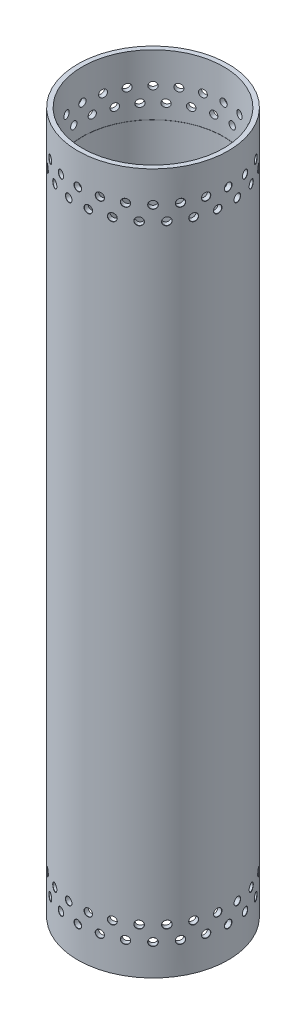
from build123d import *

# Parameters (mm, degrees)
SZKIC1_R                    = 90
SZKIC1_R_2                  = 81.5
DODANIE_WYCI_GNI_CIE1_DEPTH = 810
SZKIC2_R                    = 90
SZKIC2_R_2                  = 87
WYTNIJ_WYCI_GNI_CIE1_DEPTH  = 820.939022123
WYTNIJ_WYCI_GNI_CIE2_START  = -70
SZKIC3_R                    = 81.7
SZKIC3_R_2                  = 81.5
WYTNIJ_WYCI_GNI_CIE2_DEPTH  = 70
SZYK_KO_OWY1_COUNT          = 24


with BuildPart() as part:
    # Szkic1 → Dodanie-wyciągnięcie1 (new body)
    with BuildSketch(Plane(origin=(0, 0, 0), x_dir=(1, 0, 0), z_dir=(0, 1, 0))):
        with Locations(Location((0, 0, 0), (0, 0, 270))):
            Circle(SZKIC1_R)
        with Locations(Location((0, 0, 0), (0, 0, 270))):
            Circle(SZKIC1_R_2, mode=Mode.SUBTRACT)
    extrude(amount=DODANIE_WYCI_GNI_CIE1_DEPTH)

    # Szkic2 → Wytnij-wyciągnięcie1 (cut, through all)
    with BuildSketch(Plane(origin=(0, 810, 0), x_dir=(1, 0, 0), z_dir=(0, 1, 0))):
        Circle(SZKIC2_R)
        with Locations(Location((0, 0, 0), (0, 0, 270))):
            Circle(SZKIC2_R_2, mode=Mode.SUBTRACT)
    extrude(amount=-WYTNIJ_WYCI_GNI_CIE1_DEPTH, mode=Mode.SUBTRACT)

    # Szkic3 → Wytnij-wyciągnięcie2 (cut)
    with BuildSketch(Plane(origin=(0, 810, 0), x_dir=(1, 0, 0), z_dir=(0, 1, 0)).offset(WYTNIJ_WYCI_GNI_CIE2_START)):
        with Locations(Location((0, 0, 0), (0, 0, 270))):
            Circle(SZKIC3_R)
        with Locations(Location((0, 0, 0), (0, 0, 270))):
            Circle(SZKIC3_R_2, mode=Mode.SUBTRACT)
    wytnij_wyci_gni_cie2 = extrude(amount=WYTNIJ_WYCI_GNI_CIE2_DEPTH, mode=Mode.SUBTRACT)

    # Otwór Ø8.5 (8.5)1: read off the stored shape, not the designer's step
    # Otwór Ø8.5 (8.5)1 outline → Otwór Ø8.5 (8.5)1 (revolve, cut)
    with BuildSketch(Plane.XZ.offset(-774)):
        Polygon((0, 81.589336122), (4.25, 81.589336122), (4.25, 86.75), (4.500000084, 87.000000084), (0, 87.000000084), align=None)
    otw_r_8_5_8_5_1 = revolve(axis=Axis((0, 774, 0), (0, 0, 1)), mode=Mode.SUBTRACT)

    # Otwór Ø8.5 (8.5)2: read off the stored shape, not the designer's step
    # Otwór Ø8.5 (8.5)2 outline → Otwór Ø8.5 (8.5)2 (revolve, cut)
    with BuildSketch(Plane(origin=(0, 757, 0), x_dir=(0.9914448613738103, 0, -0.13052619222005205), z_dir=(0, -1, 0))):
        Polygon((0, 81.589323977), (4.25, 81.589323977), (4.25, 86.75), (4.500063259, 87.000063259), (0, 87.000063259), align=None)
    otw_r_8_5_8_5_2 = revolve(axis=Axis((0, 757, 0), (0.13052619222005205, 0, 0.9914448613738103)), mode=Mode.SUBTRACT)

    # Szyk kołowy1: Otwór Ø8.5 (8.5)1, Otwór Ø8.5 (8.5)2 ×24 about axis
    szyk_ko_owy1_axis = Axis((0, 0, 0), (0, 1, 0))
    add([otw_r_8_5_8_5_1.rotate(szyk_ko_owy1_axis, i * 360 / SZYK_KO_OWY1_COUNT) for i in range(1, SZYK_KO_OWY1_COUNT)], mode=Mode.SUBTRACT)
    add([otw_r_8_5_8_5_2.rotate(szyk_ko_owy1_axis, i * 360 / SZYK_KO_OWY1_COUNT) for i in range(1, SZYK_KO_OWY1_COUNT)], mode=Mode.SUBTRACT)

    # Lustro1: Wytnij-wyciągnięcie2, Otwór Ø8.5 (8.5)1, Otwór Ø8.5 (8.5)2 across plane
    add(wytnij_wyci_gni_cie2.mirror(Plane.ZX.offset(405)), mode=Mode.SUBTRACT)
    add(otw_r_8_5_8_5_1.mirror(Plane.ZX.offset(405)), mode=Mode.SUBTRACT)
    add(otw_r_8_5_8_5_2.mirror(Plane.ZX.offset(405)), mode=Mode.SUBTRACT)

    # Lustro1 copy 1 sketch → Lustro1 copy 1 (revolve, cut)
    with BuildSketch(Plane(origin=(0, 36, 0), x_dir=(0.9659258262890683, 0, -0.25881904510252074), z_dir=(0, 1, 0))):
        Polygon((0, -81.589336122), (4.25, -81.589336122), (4.25, -86.75), (4.500000084, -87.000000084), (0, -87.000000084), align=None)
    revolve(axis=Axis((0, 36, 0), (-0.25881904510252074, 0, -0.9659258262890683)), mode=Mode.SUBTRACT)

    # Lustro1 copy 2 sketch → Lustro1 copy 2 (revolve, cut)
    with BuildSketch(Plane(origin=(0, 36, 0), x_dir=(0.8660254037844387, 0, -0.49999999999999994), z_dir=(0, 1, 0))):
        Polygon((0, -81.589336122), (4.25, -81.589336122), (4.25, -86.75), (4.500000084, -87.000000084), (0, -87.000000084), align=None)
    revolve(axis=Axis((0, 36, 0), (-0.49999999999999994, 0, -0.8660254037844387)), mode=Mode.SUBTRACT)

    # Lustro1 copy 3 sketch → Lustro1 copy 3 (revolve, cut)
    with BuildSketch(Plane(origin=(0, 36, 0), x_dir=(0.7071067811865476, 0, -0.7071067811865475), z_dir=(0, 1, 0))):
        Polygon((0, -81.589336122), (4.25, -81.589336122), (4.25, -86.75), (4.500000084, -87.000000084), (0, -87.000000084), align=None)
    revolve(axis=Axis((0, 36, 0), (-0.7071067811865475, 0, -0.7071067811865476)), mode=Mode.SUBTRACT)

    # Lustro1 copy 4 sketch → Lustro1 copy 4 (revolve, cut)
    with BuildSketch(Plane(origin=(0, 36, 0), x_dir=(0.5000000000000001, 0, -0.8660254037844386), z_dir=(0, 1, 0))):
        Polygon((0, -81.589336122), (4.25, -81.589336122), (4.25, -86.75), (4.500000084, -87.000000084), (0, -87.000000084), align=None)
    revolve(axis=Axis((0, 36, 0), (-0.8660254037844386, 0, -0.5000000000000001)), mode=Mode.SUBTRACT)

    # Lustro1 copy 5 sketch → Lustro1 copy 5 (revolve, cut)
    with BuildSketch(Plane(origin=(0, 36, 0), x_dir=(0.25881904510252074, 0, -0.9659258262890683), z_dir=(0, 1, 0))):
        Polygon((0, -81.589336122), (4.25, -81.589336122), (4.25, -86.75), (4.500000084, -87.000000084), (0, -87.000000084), align=None)
    revolve(axis=Axis((0, 36, 0), (-0.9659258262890683, 0, -0.25881904510252074)), mode=Mode.SUBTRACT)

    # Lustro1 copy 6 sketch → Lustro1 copy 6 (revolve, cut)
    with BuildSketch(Plane(origin=(0, 36, 0), x_dir=(0, 0, -1), z_dir=(0, 1, 0))):
        Polygon((0, -81.589336122), (4.25, -81.589336122), (4.25, -86.75), (4.500000084, -87.000000084), (0, -87.000000084), align=None)
    revolve(axis=Axis((0, 36, 0), (-1, 0, 0)), mode=Mode.SUBTRACT)

    # Lustro1 copy 7 sketch → Lustro1 copy 7 (revolve, cut)
    with BuildSketch(Plane(origin=(0, 36, 0), x_dir=(-0.25881904510252085, 0, -0.9659258262890683), z_dir=(0, 1, 0))):
        Polygon((0, -81.589336122), (4.25, -81.589336122), (4.25, -86.75), (4.500000084, -87.000000084), (0, -87.000000084), align=None)
    revolve(axis=Axis((0, 36, 0), (-0.9659258262890683, 0, 0.25881904510252085)), mode=Mode.SUBTRACT)

    # Lustro1 copy 8 sketch → Lustro1 copy 8 (revolve, cut)
    with BuildSketch(Plane(origin=(0, 36, 0), x_dir=(-0.4999999999999998, 0, -0.8660254037844387), z_dir=(0, 1, 0))):
        Polygon((0, -81.589336122), (4.25, -81.589336122), (4.25, -86.75), (4.500000084, -87.000000084), (0, -87.000000084), align=None)
    revolve(axis=Axis((0, 36, 0), (-0.8660254037844387, 0, 0.4999999999999998)), mode=Mode.SUBTRACT)

    # Lustro1 copy 9 sketch → Lustro1 copy 9 (revolve, cut)
    with BuildSketch(Plane(origin=(0, 36, 0), x_dir=(-0.7071067811865475, 0, -0.7071067811865476), z_dir=(0, 1, 0))):
        Polygon((0, -81.589336122), (4.25, -81.589336122), (4.25, -86.75), (4.500000084, -87.000000084), (0, -87.000000084), align=None)
    revolve(axis=Axis((0, 36, 0), (-0.7071067811865476, 0, 0.7071067811865475)), mode=Mode.SUBTRACT)

    # Lustro1 copy 10 sketch → Lustro1 copy 10 (revolve, cut)
    with BuildSketch(Plane(origin=(0, 36, 0), x_dir=(-0.8660254037844387, 0, -0.49999999999999994), z_dir=(0, 1, 0))):
        Polygon((0, -81.589336122), (4.25, -81.589336122), (4.25, -86.75), (4.500000084, -87.000000084), (0, -87.000000084), align=None)
    revolve(axis=Axis((0, 36, 0), (-0.49999999999999994, 0, 0.8660254037844387)), mode=Mode.SUBTRACT)

    # Lustro1 copy 11 sketch → Lustro1 copy 11 (revolve, cut)
    with BuildSketch(Plane(origin=(0, 36, 0), x_dir=(-0.9659258262890682, 0, -0.258819045102521), z_dir=(0, 1, 0))):
        Polygon((0, -81.589336122), (4.25, -81.589336122), (4.25, -86.75), (4.500000084, -87.000000084), (0, -87.000000084), align=None)
    revolve(axis=Axis((0, 36, 0), (-0.258819045102521, 0, 0.9659258262890682)), mode=Mode.SUBTRACT)

    # Lustro1 copy 12 sketch → Lustro1 copy 12 (revolve, cut)
    with BuildSketch(Plane(origin=(0, 36, 0), x_dir=(-1, 0, 0), z_dir=(0, 1, 0))):
        Polygon((0, -81.589336122), (4.25, -81.589336122), (4.25, -86.75), (4.500000084, -87.000000084), (0, -87.000000084), align=None)
    revolve(axis=Axis((0, 36, 0), (0, 0, 1)), mode=Mode.SUBTRACT)

    # Lustro1 copy 13 sketch → Lustro1 copy 13 (revolve, cut)
    with BuildSketch(Plane(origin=(0, 36, 0), x_dir=(-0.9659258262890683, 0, 0.2588190451025208), z_dir=(0, 1, 0))):
        Polygon((0, -81.589336122), (4.25, -81.589336122), (4.25, -86.75), (4.500000084, -87.000000084), (0, -87.000000084), align=None)
    revolve(axis=Axis((0, 36, 0), (0.2588190451025208, 0, 0.9659258262890683)), mode=Mode.SUBTRACT)

    # Lustro1 copy 14 sketch → Lustro1 copy 14 (revolve, cut)
    with BuildSketch(Plane(origin=(0, 36, 0), x_dir=(-0.8660254037844386, 0, 0.5000000000000001), z_dir=(0, 1, 0))):
        Polygon((0, -81.589336122), (4.25, -81.589336122), (4.25, -86.75), (4.500000084, -87.000000084), (0, -87.000000084), align=None)
    revolve(axis=Axis((0, 36, 0), (0.5000000000000001, 0, 0.8660254037844386)), mode=Mode.SUBTRACT)

    # Lustro1 copy 15 sketch → Lustro1 copy 15 (revolve, cut)
    with BuildSketch(Plane(origin=(0, 36, 0), x_dir=(-0.7071067811865477, 0, 0.7071067811865475), z_dir=(0, 1, 0))):
        Polygon((0, -81.589336122), (4.25, -81.589336122), (4.25, -86.75), (4.500000084, -87.000000084), (0, -87.000000084), align=None)
    revolve(axis=Axis((0, 36, 0), (0.7071067811865475, 0, 0.7071067811865477)), mode=Mode.SUBTRACT)

    # Lustro1 copy 16 sketch → Lustro1 copy 16 (revolve, cut)
    with BuildSketch(Plane(origin=(0, 36, 0), x_dir=(-0.5000000000000004, 0, 0.8660254037844384), z_dir=(0, 1, 0))):
        Polygon((0, -81.589336122), (4.25, -81.589336122), (4.25, -86.75), (4.500000084, -87.000000084), (0, -87.000000084), align=None)
    revolve(axis=Axis((0, 36, 0), (0.8660254037844384, 0, 0.5000000000000004)), mode=Mode.SUBTRACT)

    # Lustro1 copy 17 sketch → Lustro1 copy 17 (revolve, cut)
    with BuildSketch(Plane(origin=(0, 36, 0), x_dir=(-0.25881904510252063, 0, 0.9659258262890683), z_dir=(0, 1, 0))):
        Polygon((0, -81.589336122), (4.25, -81.589336122), (4.25, -86.75), (4.500000084, -87.000000084), (0, -87.000000084), align=None)
    revolve(axis=Axis((0, 36, 0), (0.9659258262890683, 0, 0.25881904510252063)), mode=Mode.SUBTRACT)

    # Lustro1 copy 18 sketch → Lustro1 copy 18 (revolve, cut)
    with BuildSketch(Plane.ZX.offset(36)):
        Polygon((0, -81.589336122), (4.25, -81.589336122), (4.25, -86.75), (4.500000084, -87.000000084), (0, -87.000000084), align=None)
    revolve(axis=Axis((0, 36, 0), (1, 0, 0)), mode=Mode.SUBTRACT)

    # Lustro1 copy 19 sketch → Lustro1 copy 19 (revolve, cut)
    with BuildSketch(Plane(origin=(0, 36, 0), x_dir=(0.2588190451025203, 0, 0.9659258262890684), z_dir=(0, 1, 0))):
        Polygon((0, -81.589336122), (4.25, -81.589336122), (4.25, -86.75), (4.500000084, -87.000000084), (0, -87.000000084), align=None)
    revolve(axis=Axis((0, 36, 0), (0.9659258262890684, 0, -0.2588190451025203)), mode=Mode.SUBTRACT)

    # Lustro1 copy 20 sketch → Lustro1 copy 20 (revolve, cut)
    with BuildSketch(Plane(origin=(0, 36, 0), x_dir=(0.5000000000000001, 0, 0.8660254037844386), z_dir=(0, 1, 0))):
        Polygon((0, -81.589336122), (4.25, -81.589336122), (4.25, -86.75), (4.500000084, -87.000000084), (0, -87.000000084), align=None)
    revolve(axis=Axis((0, 36, 0), (0.8660254037844386, 0, -0.5000000000000001)), mode=Mode.SUBTRACT)

    # Lustro1 copy 21 sketch → Lustro1 copy 21 (revolve, cut)
    with BuildSketch(Plane(origin=(0, 36, 0), x_dir=(0.7071067811865474, 0, 0.7071067811865477), z_dir=(0, 1, 0))):
        Polygon((0, -81.589336122), (4.25, -81.589336122), (4.25, -86.75), (4.500000084, -87.000000084), (0, -87.000000084), align=None)
    revolve(axis=Axis((0, 36, 0), (0.7071067811865477, 0, -0.7071067811865474)), mode=Mode.SUBTRACT)

    # Lustro1 copy 22 sketch → Lustro1 copy 22 (revolve, cut)
    with BuildSketch(Plane(origin=(0, 36, 0), x_dir=(0.8660254037844384, 0, 0.5000000000000004), z_dir=(0, 1, 0))):
        Polygon((0, -81.589336122), (4.25, -81.589336122), (4.25, -86.75), (4.500000084, -87.000000084), (0, -87.000000084), align=None)
    revolve(axis=Axis((0, 36, 0), (0.5000000000000004, 0, -0.8660254037844384)), mode=Mode.SUBTRACT)

    # Lustro1 copy 23 sketch → Lustro1 copy 23 (revolve, cut)
    with BuildSketch(Plane(origin=(0, 36, 0), x_dir=(0.9659258262890683, 0, 0.2588190451025207), z_dir=(0, 1, 0))):
        Polygon((0, -81.589336122), (4.25, -81.589336122), (4.25, -86.75), (4.500000084, -87.000000084), (0, -87.000000084), align=None)
    revolve(axis=Axis((0, 36, 0), (0.2588190451025207, 0, -0.9659258262890683)), mode=Mode.SUBTRACT)

    # Lustro1 copy 24 sketch → Lustro1 copy 24 (revolve, cut)
    with BuildSketch(Plane(origin=(0, 53, 0), x_dir=(0.9238795325112865, 0, -0.38268343236509017), z_dir=(0, 1, 0))):
        Polygon((0, -81.589323977), (4.25, -81.589323977), (4.25, -86.75), (4.500063259, -87.000063259), (0, -87.000063259), align=None)
    revolve(axis=Axis((0, 53, 0), (-0.38268343236509017, 0, -0.9238795325112865)), mode=Mode.SUBTRACT)

    # Lustro1 copy 25 sketch → Lustro1 copy 25 (revolve, cut)
    with BuildSketch(Plane(origin=(0, 53, 0), x_dir=(0.7933533402912349, 0, -0.6087614290087209), z_dir=(0, 1, 0))):
        Polygon((0, -81.589323977), (4.25, -81.589323977), (4.25, -86.75), (4.500063259, -87.000063259), (0, -87.000063259), align=None)
    revolve(axis=Axis((0, 53, 0), (-0.6087614290087209, 0, -0.7933533402912349)), mode=Mode.SUBTRACT)

    # Lustro1 copy 26 sketch → Lustro1 copy 26 (revolve, cut)
    with BuildSketch(Plane(origin=(0, 53, 0), x_dir=(0.6087614290087202, 0, -0.7933533402912353), z_dir=(0, 1, 0))):
        Polygon((0, -81.589323977), (4.25, -81.589323977), (4.25, -86.75), (4.500063259, -87.000063259), (0, -87.000063259), align=None)
    revolve(axis=Axis((0, 53, 0), (-0.7933533402912353, 0, -0.6087614290087202)), mode=Mode.SUBTRACT)

    # Lustro1 copy 27 sketch → Lustro1 copy 27 (revolve, cut)
    with BuildSketch(Plane(origin=(0, 53, 0), x_dir=(0.3826834323650894, 0, -0.9238795325112868), z_dir=(0, 1, 0))):
        Polygon((0, -81.589323977), (4.25, -81.589323977), (4.25, -86.75), (4.500063259, -87.000063259), (0, -87.000063259), align=None)
    revolve(axis=Axis((0, 53, 0), (-0.9238795325112868, 0, -0.3826834323650894)), mode=Mode.SUBTRACT)

    # Lustro1 copy 28 sketch → Lustro1 copy 28 (revolve, cut)
    with BuildSketch(Plane(origin=(0, 53, 0), x_dir=(0.13052619222005113, 0, -0.9914448613738105), z_dir=(0, 1, 0))):
        Polygon((0, -81.589323977), (4.25, -81.589323977), (4.25, -86.75), (4.500063259, -87.000063259), (0, -87.000063259), align=None)
    revolve(axis=Axis((0, 53, 0), (-0.9914448613738105, 0, -0.13052619222005113)), mode=Mode.SUBTRACT)

    # Lustro1 copy 29 sketch → Lustro1 copy 29 (revolve, cut)
    with BuildSketch(Plane(origin=(0, 53, 0), x_dir=(-0.130526192220052, 0, -0.9914448613738103), z_dir=(0, 1, 0))):
        Polygon((0, -81.589323977), (4.25, -81.589323977), (4.25, -86.75), (4.500063259, -87.000063259), (0, -87.000063259), align=None)
    revolve(axis=Axis((0, 53, 0), (-0.9914448613738103, 0, 0.130526192220052)), mode=Mode.SUBTRACT)

    # Lustro1 copy 30 sketch → Lustro1 copy 30 (revolve, cut)
    with BuildSketch(Plane(origin=(0, 53, 0), x_dir=(-0.3826834323650902, 0, -0.9238795325112865), z_dir=(0, 1, 0))):
        Polygon((0, -81.589323977), (4.25, -81.589323977), (4.25, -86.75), (4.500063259, -87.000063259), (0, -87.000063259), align=None)
    revolve(axis=Axis((0, 53, 0), (-0.9238795325112865, 0, 0.3826834323650902)), mode=Mode.SUBTRACT)

    # Lustro1 copy 31 sketch → Lustro1 copy 31 (revolve, cut)
    with BuildSketch(Plane(origin=(0, 53, 0), x_dir=(-0.6087614290087208, 0, -0.7933533402912349), z_dir=(0, 1, 0))):
        Polygon((0, -81.589323977), (4.25, -81.589323977), (4.25, -86.75), (4.500063259, -87.000063259), (0, -87.000063259), align=None)
    revolve(axis=Axis((0, 53, 0), (-0.7933533402912349, 0, 0.6087614290087208)), mode=Mode.SUBTRACT)

    # Lustro1 copy 32 sketch → Lustro1 copy 32 (revolve, cut)
    with BuildSketch(Plane(origin=(0, 53, 0), x_dir=(-0.7933533402912353, 0, -0.6087614290087202), z_dir=(0, 1, 0))):
        Polygon((0, -81.589323977), (4.25, -81.589323977), (4.25, -86.75), (4.500063259, -87.000063259), (0, -87.000063259), align=None)
    revolve(axis=Axis((0, 53, 0), (-0.6087614290087202, 0, 0.7933533402912353)), mode=Mode.SUBTRACT)

    # Lustro1 copy 33 sketch → Lustro1 copy 33 (revolve, cut)
    with BuildSketch(Plane(origin=(0, 53, 0), x_dir=(-0.923879532511287, 0, -0.3826834323650892), z_dir=(0, 1, 0))):
        Polygon((0, -81.589323977), (4.25, -81.589323977), (4.25, -86.75), (4.500063259, -87.000063259), (0, -87.000063259), align=None)
    revolve(axis=Axis((0, 53, 0), (-0.3826834323650892, 0, 0.923879532511287)), mode=Mode.SUBTRACT)

    # Lustro1 copy 34 sketch → Lustro1 copy 34 (revolve, cut)
    with BuildSketch(Plane(origin=(0, 53, 0), x_dir=(-0.9914448613738104, 0, -0.13052619222005135), z_dir=(0, 1, 0))):
        Polygon((0, -81.589323977), (4.25, -81.589323977), (4.25, -86.75), (4.500063259, -87.000063259), (0, -87.000063259), align=None)
    revolve(axis=Axis((0, 53, 0), (-0.13052619222005135, 0, 0.9914448613738104)), mode=Mode.SUBTRACT)

    # Lustro1 copy 35 sketch → Lustro1 copy 35 (revolve, cut)
    with BuildSketch(Plane(origin=(0, 53, 0), x_dir=(-0.9914448613738103, 0, 0.13052619222005193), z_dir=(0, 1, 0))):
        Polygon((0, -81.589323977), (4.25, -81.589323977), (4.25, -86.75), (4.500063259, -87.000063259), (0, -87.000063259), align=None)
    revolve(axis=Axis((0, 53, 0), (0.13052619222005193, 0, 0.9914448613738103)), mode=Mode.SUBTRACT)

    # Lustro1 copy 36 sketch → Lustro1 copy 36 (revolve, cut)
    with BuildSketch(Plane(origin=(0, 53, 0), x_dir=(-0.9238795325112865, 0, 0.3826834323650902), z_dir=(0, 1, 0))):
        Polygon((0, -81.589323977), (4.25, -81.589323977), (4.25, -86.75), (4.500063259, -87.000063259), (0, -87.000063259), align=None)
    revolve(axis=Axis((0, 53, 0), (0.3826834323650902, 0, 0.9238795325112865)), mode=Mode.SUBTRACT)

    # Lustro1 copy 37 sketch → Lustro1 copy 37 (revolve, cut)
    with BuildSketch(Plane(origin=(0, 53, 0), x_dir=(-0.7933533402912348, 0, 0.6087614290087211), z_dir=(0, 1, 0))):
        Polygon((0, -81.589323977), (4.25, -81.589323977), (4.25, -86.75), (4.500063259, -87.000063259), (0, -87.000063259), align=None)
    revolve(axis=Axis((0, 53, 0), (0.6087614290087211, 0, 0.7933533402912348)), mode=Mode.SUBTRACT)

    # Lustro1 copy 38 sketch → Lustro1 copy 38 (revolve, cut)
    with BuildSketch(Plane(origin=(0, 53, 0), x_dir=(-0.6087614290087203, 0, 0.7933533402912353), z_dir=(0, 1, 0))):
        Polygon((0, -81.589323977), (4.25, -81.589323977), (4.25, -86.75), (4.500063259, -87.000063259), (0, -87.000063259), align=None)
    revolve(axis=Axis((0, 53, 0), (0.7933533402912353, 0, 0.6087614290087203)), mode=Mode.SUBTRACT)

    # Lustro1 copy 39 sketch → Lustro1 copy 39 (revolve, cut)
    with BuildSketch(Plane(origin=(0, 53, 0), x_dir=(-0.3826834323650898, 0, 0.9238795325112867), z_dir=(0, 1, 0))):
        Polygon((0, -81.589323977), (4.25, -81.589323977), (4.25, -86.75), (4.500063259, -87.000063259), (0, -87.000063259), align=None)
    revolve(axis=Axis((0, 53, 0), (0.9238795325112867, 0, 0.3826834323650898)), mode=Mode.SUBTRACT)

    # Lustro1 copy 40 sketch → Lustro1 copy 40 (revolve, cut)
    with BuildSketch(Plane(origin=(0, 53, 0), x_dir=(-0.13052619222005102, 0, 0.9914448613738104), z_dir=(0, 1, 0))):
        Polygon((0, -81.589323977), (4.25, -81.589323977), (4.25, -86.75), (4.500063259, -87.000063259), (0, -87.000063259), align=None)
    revolve(axis=Axis((0, 53, 0), (0.9914448613738104, 0, 0.13052619222005102)), mode=Mode.SUBTRACT)

    # Lustro1 copy 41 sketch → Lustro1 copy 41 (revolve, cut)
    with BuildSketch(Plane(origin=(0, 53, 0), x_dir=(0.13052619222005185, 0, 0.9914448613738103), z_dir=(0, 1, 0))):
        Polygon((0, -81.589323977), (4.25, -81.589323977), (4.25, -86.75), (4.500063259, -87.000063259), (0, -87.000063259), align=None)
    revolve(axis=Axis((0, 53, 0), (0.9914448613738103, 0, -0.13052619222005185)), mode=Mode.SUBTRACT)

    # Lustro1 copy 42 sketch → Lustro1 copy 42 (revolve, cut)
    with BuildSketch(Plane(origin=(0, 53, 0), x_dir=(0.3826834323650897, 0, 0.9238795325112867), z_dir=(0, 1, 0))):
        Polygon((0, -81.589323977), (4.25, -81.589323977), (4.25, -86.75), (4.500063259, -87.000063259), (0, -87.000063259), align=None)
    revolve(axis=Axis((0, 53, 0), (0.9238795325112867, 0, -0.3826834323650897)), mode=Mode.SUBTRACT)

    # Lustro1 copy 43 sketch → Lustro1 copy 43 (revolve, cut)
    with BuildSketch(Plane(origin=(0, 53, 0), x_dir=(0.6087614290087211, 0, 0.7933533402912348), z_dir=(0, 1, 0))):
        Polygon((0, -81.589323977), (4.25, -81.589323977), (4.25, -86.75), (4.500063259, -87.000063259), (0, -87.000063259), align=None)
    revolve(axis=Axis((0, 53, 0), (0.7933533402912348, 0, -0.6087614290087211)), mode=Mode.SUBTRACT)

    # Lustro1 copy 44 sketch → Lustro1 copy 44 (revolve, cut)
    with BuildSketch(Plane(origin=(0, 53, 0), x_dir=(0.7933533402912352, 0, 0.6087614290087203), z_dir=(0, 1, 0))):
        Polygon((0, -81.589323977), (4.25, -81.589323977), (4.25, -86.75), (4.500063259, -87.000063259), (0, -87.000063259), align=None)
    revolve(axis=Axis((0, 53, 0), (0.6087614290087203, 0, -0.7933533402912352)), mode=Mode.SUBTRACT)

    # Lustro1 copy 45 sketch → Lustro1 copy 45 (revolve, cut)
    with BuildSketch(Plane(origin=(0, 53, 0), x_dir=(0.9238795325112867, 0, 0.3826834323650898), z_dir=(0, 1, 0))):
        Polygon((0, -81.589323977), (4.25, -81.589323977), (4.25, -86.75), (4.500063259, -87.000063259), (0, -87.000063259), align=None)
    revolve(axis=Axis((0, 53, 0), (0.3826834323650898, 0, -0.9238795325112867)), mode=Mode.SUBTRACT)

    # Lustro1 copy 46 sketch → Lustro1 copy 46 (revolve, cut)
    with BuildSketch(Plane(origin=(0, 53, 0), x_dir=(0.9914448613738105, 0, 0.13052619222005107), z_dir=(0, 1, 0))):
        Polygon((0, -81.589323977), (4.25, -81.589323977), (4.25, -86.75), (4.500063259, -87.000063259), (0, -87.000063259), align=None)
    revolve(axis=Axis((0, 53, 0), (0.13052619222005107, 0, -0.9914448613738105)), mode=Mode.SUBTRACT)


solid = part.part
